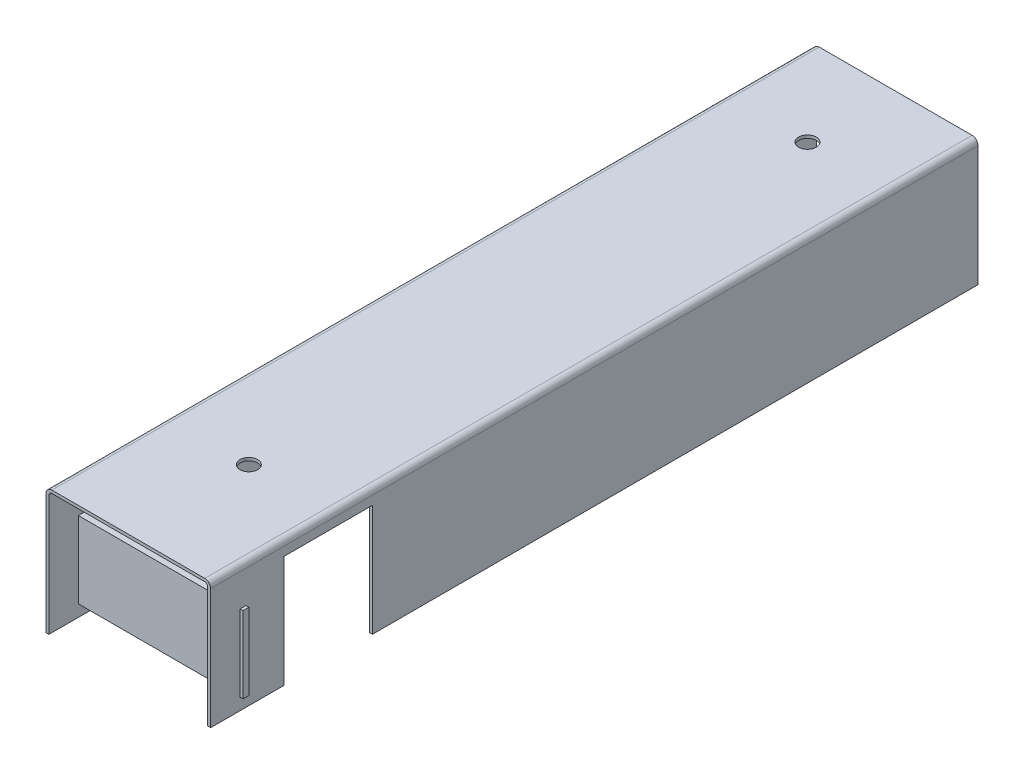
from build123d import *

# Parameters (mm, degrees)
BOSS_EXTRUDE1_DEPTH      = 261
FILLET1_R                = 2
FILLET2_R                = 1
BOSS_EXTRUDE2_DEPTH      = 56
BOSS_EXTRUDE2_DEPTH_BACK = 2
SKETCH2_W                = 2
SKETCH2_H                = 26
SKETCH3_R                = 3
CUT_EXTRUDE1_DEPTH       = 11
SKETCH4_W                = 30
SKETCH4_H                = 40
CUT_EXTRUDE2_DEPTH       = 10


with BuildPart() as part:
    # Sketch1 → Boss-Extrude1 (new body)
    with BuildSketch(Plane.XY):
        Polygon((28, 21.5), (-28, 21.5), (-28, -21.5), (-27, -21.5), (-27, -20.5), (-27, 20.5), (27, 20.5), (27, -20.5), (27, -21.5), (28, -21.5), align=None)
    extrude(amount=BOSS_EXTRUDE1_DEPTH)

    # Fillet1
    fillet1_edges = [part.edges().sort_by_distance(p)[0] for p in [
        (-28, 21.5, 130.5),
        (28, 21.5, 130.5),
    ]]
    fillet(fillet1_edges, radius=FILLET1_R)

    # Fillet2
    fillet2_edges = [part.edges().sort_by_distance(p)[0] for p in [
        (27, 20.5, 130.5),
        (-27, 20.5, 130.5),
    ]]
    fillet(fillet2_edges, radius=FILLET2_R)

    # Sketch2 → Boss-Extrude2 (add, two sides: drawn at the far end of the back side and taken through both)
    with BuildSketch(Plane(origin=(-27, 0, 0), x_dir=(0, 0, -1), z_dir=(1, 0, 0)).offset(-BOSS_EXTRUDE2_DEPTH_BACK)):
        with Locations((-250, -4.5)):
            Rectangle(SKETCH2_W, SKETCH2_H)
    extrude(amount=BOSS_EXTRUDE2_DEPTH + BOSS_EXTRUDE2_DEPTH_BACK)

    # Sketch3 → Cut-Extrude1 (cut)
    with BuildSketch(Plane(origin=(0, 21.5, 0), x_dir=(1, 0, 0), z_dir=(0, 1, 0))):
        with Locations((0, -30)):
            Circle(SKETCH3_R)
        with Locations((0, -220)):
            Circle(SKETCH3_R)
    extrude(amount=-CUT_EXTRUDE1_DEPTH, mode=Mode.SUBTRACT)

    # Sketch4 → Cut-Extrude2 (cut)
    with BuildSketch(Plane(origin=(28, 0, 0), x_dir=(0, 0, -1), z_dir=(1, 0, 0))):
        with Locations((-221, -3.5)):
            Rectangle(SKETCH4_W, SKETCH4_H)
    extrude(amount=-CUT_EXTRUDE2_DEPTH, mode=Mode.SUBTRACT)


solid = part.part
